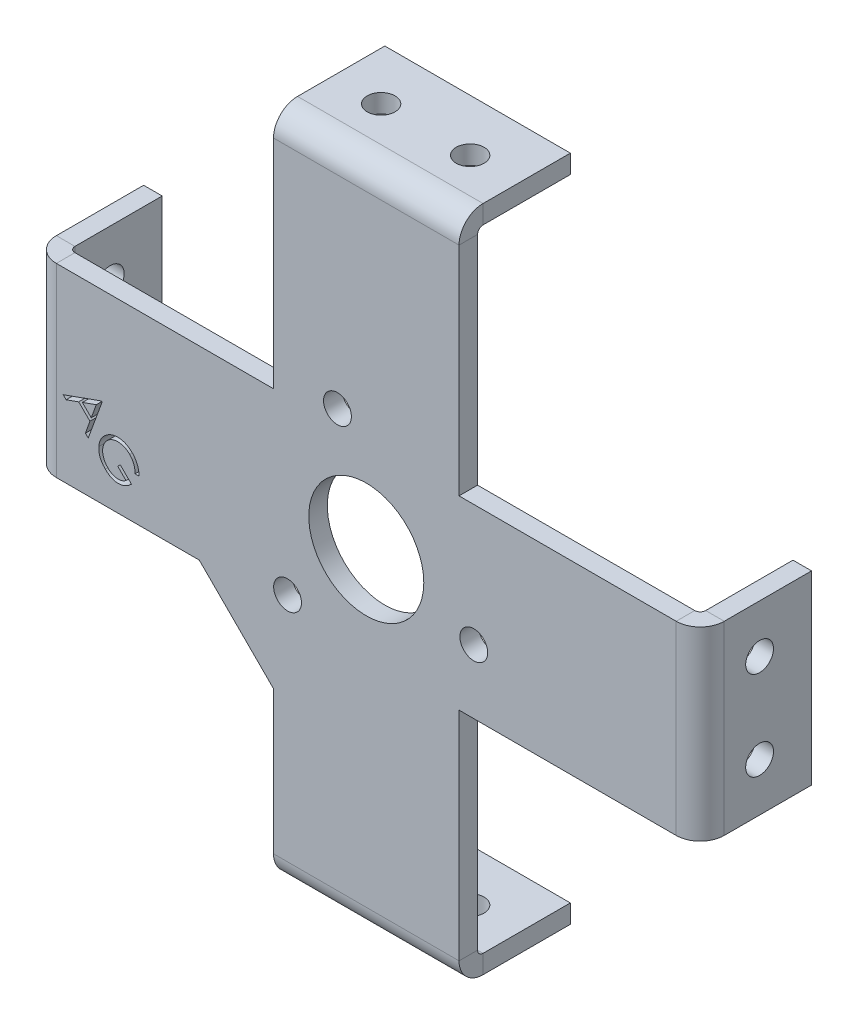
from build123d import *

# Parameters (mm, degrees)
SKETCH1_R                    = 7.75
SKETCH1_R_2                  = 1.875
BASE_FLANGE1_DEPTH           = 2.5
EDGE_FLANGE1_STRIP_W         = 11.4732
EDGE_FLANGE1_STRIP_H         = 2.5
EDGE_FLANGE1_STRIP_CUT_DEPTH = 25
EDGE_FLANGE1_DEPTH           = 25
EDGE_FLANGE2_STRIP_W         = 11.4732
EDGE_FLANGE2_STRIP_H         = 2.5
EDGE_FLANGE2_STRIP_CUT_DEPTH = 25
EDGE_FLANGE2_DEPTH           = 25
EDGE_FLANGE3_STRIP_W         = 11.4732
EDGE_FLANGE3_STRIP_H         = 2.5
EDGE_FLANGE3_STRIP_CUT_DEPTH = 25
EDGE_FLANGE3_DEPTH           = 25
EDGE_FLANGE4_STRIP_W         = 11.4732
EDGE_FLANGE4_STRIP_H         = 2.5
EDGE_FLANGE4_STRIP_CUT_DEPTH = 25
EDGE_FLANGE4_DEPTH           = 25
SKETCH18_R                   = 1.875
CUT_EXTRUDE1_DEPTH           = 102.734949747
CIRPATTERN1_COUNT            = 2
CIRPATTERN1_ANGLE            = 90
CHAMFER1_SIZE                = 10
CUT_EXTRUDE2_REACH           = 67.383


# Sheet-metal steps are written as plain solids
with BuildPart() as part:
    # Sketch1 → Base-Flange1 (new body)
    with BuildSketch(Plane.XY):
        Polygon((-45, 12.5), (-12.5, 12.5), (-12.5, 45), (12.5, 45), (12.5, 12.5), (45, 12.5), (45, -12.5), (12.5, -12.5), (12.5, -45), (-12.5, -45), (-12.5, -12.5), (-45, -12.5), align=None)
        Circle(SKETCH1_R, mode=Mode.SUBTRACT)
        with Locations((14.488887394, -3.882285677)):
            Circle(SKETCH1_R_2, mode=Mode.SUBTRACT)
        with Locations((-3.882285677, 14.488887394)):
            Circle(SKETCH1_R_2, mode=Mode.SUBTRACT)
        with Locations((-10.606601718, -10.606601718)):
            Circle(SKETCH1_R_2, mode=Mode.SUBTRACT)
    extrude(amount=-BASE_FLANGE1_DEPTH)

    # Edge-Flange1 strip (across the edge) → Edge-Flange1 strip cut (cut)
    with BuildSketch(Plane(origin=(-45, -12.5, -2.5), x_dir=(1, 0, 0), z_dir=(0, 1, 0))):
        with Locations((-2.5, -1.25)):
            Rectangle(EDGE_FLANGE1_STRIP_W, EDGE_FLANGE1_STRIP_H)
    extrude(amount=EDGE_FLANGE1_STRIP_CUT_DEPTH, mode=Mode.SUBTRACT)

    # Edge-Flange1 section (across the edge) → Edge-Flange1 (add)
    with BuildSketch(Plane(origin=(-45, -12.5, -2.5), x_dir=(1, 0, 0), z_dir=(0, 1, 0))):
        with BuildLine():
            Line((0, 0.7366), (0, 12.5))
            Line((0, 12.5), (2.5, 12.5))
            Line((2.5, 12.5), (2.5, 0.7366))
            ThreePointArc((2.5, 0.7366), (2.715745145, 0.215745145), (3.2366, 0))
            Line((3.2366, 0), (3.2366, -2.5))
            ThreePointArc((3.2366, -2.5), (0.947978192, -1.552021808), (0, 0.7366))
        make_face()
    extrude(amount=EDGE_FLANGE1_DEPTH)

    # Edge-Flange2 strip (across the edge) → Edge-Flange2 strip cut (cut)
    with BuildSketch(Plane(origin=(-12.5, 45, -2.5), x_dir=(0, -1, 0), z_dir=(1, 0, 0))):
        with Locations((-2.5, -1.25)):
            Rectangle(EDGE_FLANGE2_STRIP_W, EDGE_FLANGE2_STRIP_H)
    extrude(amount=EDGE_FLANGE2_STRIP_CUT_DEPTH, mode=Mode.SUBTRACT)

    # Edge-Flange2 section (across the edge) → Edge-Flange2 (add)
    with BuildSketch(Plane(origin=(-12.5, 45, -2.5), x_dir=(0, -1, 0), z_dir=(1, 0, 0))):
        with BuildLine():
            Line((0, 0.7366), (0, 12.5))
            Line((0, 12.5), (2.5, 12.5))
            Line((2.5, 12.5), (2.5, 0.7366))
            ThreePointArc((2.5, 0.7366), (2.715745145, 0.215745145), (3.2366, 0))
            Line((3.2366, 0), (3.2366, -2.5))
            ThreePointArc((3.2366, -2.5), (0.947978192, -1.552021808), (0, 0.7366))
        make_face()
    extrude(amount=EDGE_FLANGE2_DEPTH)

    # Edge-Flange3 strip (across the edge) → Edge-Flange3 strip cut (cut)
    with BuildSketch(Plane(origin=(45, 12.5, -2.5), x_dir=(-1, 0, 0), z_dir=(0, -1, 0))):
        with Locations((-2.5, -1.25)):
            Rectangle(EDGE_FLANGE3_STRIP_W, EDGE_FLANGE3_STRIP_H)
    extrude(amount=EDGE_FLANGE3_STRIP_CUT_DEPTH, mode=Mode.SUBTRACT)

    # Edge-Flange3 section (across the edge) → Edge-Flange3 (add)
    with BuildSketch(Plane(origin=(45, 12.5, -2.5), x_dir=(-1, 0, 0), z_dir=(0, -1, 0))):
        with BuildLine():
            Line((0, 0.7366), (0, 12.5))
            Line((0, 12.5), (2.5, 12.5))
            Line((2.5, 12.5), (2.5, 0.7366))
            ThreePointArc((2.5, 0.7366), (2.715745145, 0.215745145), (3.2366, 0))
            Line((3.2366, 0), (3.2366, -2.5))
            ThreePointArc((3.2366, -2.5), (0.947978192, -1.552021808), (0, 0.7366))
        make_face()
    extrude(amount=EDGE_FLANGE3_DEPTH)

    # Edge-Flange4 strip (across the edge) → Edge-Flange4 strip cut (cut)
    with BuildSketch(Plane(origin=(12.5, -45, -2.5), x_dir=(0, 1, 0), z_dir=(-1, 0, 0))):
        with Locations((-2.5, -1.25)):
            Rectangle(EDGE_FLANGE4_STRIP_W, EDGE_FLANGE4_STRIP_H)
    extrude(amount=EDGE_FLANGE4_STRIP_CUT_DEPTH, mode=Mode.SUBTRACT)

    # Edge-Flange4 section (across the edge) → Edge-Flange4 (add)
    with BuildSketch(Plane(origin=(12.5, -45, -2.5), x_dir=(0, 1, 0), z_dir=(-1, 0, 0))):
        with BuildLine():
            Line((0, 0.7366), (0, 12.5))
            Line((0, 12.5), (2.5, 12.5))
            Line((2.5, 12.5), (2.5, 0.7366))
            ThreePointArc((2.5, 0.7366), (2.715745145, 0.215745145), (3.2366, 0))
            Line((3.2366, 0), (3.2366, -2.5))
            ThreePointArc((3.2366, -2.5), (0.947978192, -1.552021808), (0, 0.7366))
        make_face()
    extrude(amount=EDGE_FLANGE4_DEPTH)

    # Sketch18 → Cut-Extrude1 (cut, through all)
    with BuildSketch(Plane.XZ.offset(45)):
        with Locations(Location((6, -8, 0), (0, 0, 270))):
            Circle(SKETCH18_R)
        with Locations(Location((-6, -8, 0), (0, 0, 270))):
            Circle(SKETCH18_R)
    cut_extrude1 = extrude(amount=-CUT_EXTRUDE1_DEPTH, mode=Mode.SUBTRACT)

    # CirPattern1: Cut-Extrude1 ×2 about axis
    cirpattern1_axis = Axis((0, 0, -2.5), (0, 0, 1))
    for i in range(1, CIRPATTERN1_COUNT):
        add(cut_extrude1.rotate(cirpattern1_axis, i * CIRPATTERN1_ANGLE / (CIRPATTERN1_COUNT - 1)), mode=Mode.SUBTRACT)

    # Chamfer1
    chamfer1_edges = [part.edges().sort_by_distance(p)[0] for p in [
        (-12.5, -12.5, -1.25),
    ]]
    chamfer(chamfer1_edges, length=CHAMFER1_SIZE)

    # Sketch19 → Cut-Extrude2 (cut, up to next)
    with BuildSketch(Plane.XY, mode=Mode.PRIVATE) as cut_extrude2_sk1:
        Polygon((-35.59875844, -0.60445976), (-37.466747222, -5.735669696), (-37.842348184, -5.360068735), (-37.240385043, -3.658345978), (-38.748798504, -2.149932517), (-40.447516453, -2.754900466), (-40.838141453, -2.364275466), (-35.684896261, -0.51832194), align=None)
        Polygon((-36.38401485, -1.30357835), (-38.254006837, -1.969644055), (-37.057091773, -3.166559119), align=None, mode=Mode.SUBTRACT)
    cut_extrude2_tool1 = extrude(cut_extrude2_sk1.sketch, amount=-CUT_EXTRUDE2_REACH, mode=Mode.PRIVATE) & part.part
    # Sketch19 → Cut-Extrude2 (cut, up to next)
    with BuildSketch(Plane.XY, mode=Mode.PRIVATE) as cut_extrude2_sk2:
        with BuildLine():
            Line((-30.615398344, -6.763701267), (-31.142241293, -6.749678831))
            add(Edge.make_bspline(
                [(-31.142241293, -6.749678831), (-31.145489868, -6.654395136), (-31.151888753, -6.466709961), (-31.191755294, -6.19060039), (-31.256051919, -5.925522565), (-31.342853817, -5.672300597), (-31.450583003, -5.435210498), (-31.574868793, -5.216438847), (-31.715950903, -5.017962189), (-31.82468821, -4.901283993), (-31.878419178, -4.843629151)],
                knots=[0, 0, 0, 0, 1.092456216, 2.151866967, 3.191698867, 4.215812801, 5.216260249, 6.172962659, 7.097195931, 8, 8, 8, 8], degree=3))
            add(Edge.make_bspline(
                [(-31.878419178, -4.843629151), (-31.913029226, -4.810085313), (-31.981877561, -4.743357945), (-32.093010927, -4.652076639), (-32.208789876, -4.568188826), (-32.329828018, -4.491475146), (-32.455649736, -4.422623603), (-32.586818346, -4.361190038), (-32.722841699, -4.307003842), (-32.863536633, -4.261560473), (-33.005791237, -4.223261605), (-33.148663359, -4.195070624), (-33.290893746, -4.176907132), (-33.432461427, -4.16918509), (-33.573012941, -4.169771608), (-33.712914336, -4.1810242), (-33.852200007, -4.201892822), (-33.989800368, -4.233397375), (-34.124546629, -4.271682787), (-34.254281199, -4.319621186), (-34.379576304, -4.372979421), (-34.49928237, -4.435542074), (-34.613457645, -4.505890078), (-34.723144014, -4.583122338), (-34.827513812, -4.668237285), (-34.892633759, -4.730347054), (-34.925294178, -4.761497741)],
                knots=[0, 0, 0, 0, 1.025427365, 2.039840153, 3.057507816, 4.066806032, 5.087569815, 6.10793782, 7.147691792, 8.201553679, 9.252921328, 10.281347815, 11.298419945, 12.301923675, 13.296735835, 14.287504905, 15.286394337, 16.291406341, 17.289891323, 18.265459552, 19.232998703, 20.186450044, 21.137010966, 22.085285157, 23.039689209, 24, 24, 24, 24], degree=3))
            add(Edge.make_bspline(
                [(-34.925294178, -4.761497741), (-34.957616924, -4.794680579), (-35.021940545, -4.86071582), (-35.107450015, -4.969113982), (-35.187133222, -5.080988473), (-35.258292268, -5.199057829), (-35.322776116, -5.321766455), (-35.377378419, -5.450817312), (-35.42604101, -5.584313896), (-35.46565681, -5.722898014), (-35.496841632, -5.86436058), (-35.517459985, -6.006989821), (-35.530372175, -6.149454769), (-35.530520308, -6.292393273), (-35.523003453, -6.435967526), (-35.504515049, -6.579747446), (-35.477815116, -6.724165432), (-35.439446432, -6.867504275), (-35.39246711, -7.009238615), (-35.337784018, -7.147770936), (-35.272912139, -7.281648686), (-35.200205185, -7.411575126), (-35.118210821, -7.537195049), (-35.029540664, -7.659634789), (-34.931025433, -7.777351247), (-34.859328291, -7.851211358), (-34.823130716, -7.888500946)],
                knots=[0, 0, 0, 0, 0.958164642, 1.906787844, 2.853899696, 3.799624022, 4.757763745, 5.720477666, 6.697567859, 7.697077279, 8.701447969, 9.693380152, 10.678137543, 11.659421694, 12.649136943, 13.651961257, 14.657591078, 15.68673578, 16.720348352, 17.746914642, 18.766854241, 19.797135108, 20.826418999, 21.869962865, 22.924612933, 24, 24, 24, 24], degree=3))
            add(Edge.make_bspline(
                [(-34.823130716, -7.888500946), (-34.778003815, -7.931585494), (-34.68922766, -8.016343818), (-34.5474528, -8.129926389), (-34.401033898, -8.228445627), (-34.250044472, -8.311837301), (-34.095490563, -8.3814978), (-33.936261805, -8.436059368), (-33.772470152, -8.474812717), (-33.605974627, -8.49983072), (-33.439002376, -8.510326079), (-33.274766388, -8.503748511), (-33.113947527, -8.484342118), (-32.957382104, -8.447780334), (-32.804395886, -8.396572016), (-32.655665758, -8.329872049), (-32.51046355, -8.248868694), (-32.419372798, -8.18386345), (-32.373210844, -8.150920818)],
                knots=[0, 0, 0, 0, 1.108635511, 2.180969593, 3.22450757, 4.241882241, 5.243346914, 6.234258488, 7.228894973, 8.231010033, 9.223856758, 10.197775715, 11.148806295, 12.098929147, 13.050404013, 14.012095734, 14.992592072, 16, 16, 16, 16], degree=3))
            Line((-32.373210844, -8.150920818), (-33.488996101, -7.035135561))
            Line((-33.488996101, -7.035135561), (-33.151456036, -6.697595497))
            Line((-33.151456036, -6.697595497), (-31.643042575, -8.206008959))
            add(Edge.make_bspline(
                [(-31.643042575, -8.206008959), (-31.710847329, -8.269879572), (-31.843432408, -8.39477185), (-32.054280455, -8.559411619), (-32.269615783, -8.698951269), (-32.489679156, -8.812748059), (-32.714099891, -8.901650717), (-32.943034663, -8.965383789), (-33.176470493, -9.003567716), (-33.412824348, -9.016306456), (-33.648712009, -9.005073725), (-33.880824811, -8.965810593), (-34.108618105, -8.904250507), (-34.330773532, -8.814380371), (-34.549047899, -8.702379799), (-34.761079824, -8.563186417), (-34.96957641, -8.401111192), (-35.099313736, -8.276674023), (-35.165678793, -8.213020177)],
                knots=[0, 0, 0, 0, 1.124353718, 2.198555655, 3.225130206, 4.218636519, 5.185134441, 6.134880843, 7.082657188, 8.035538682, 8.98820694, 9.928027176, 10.872814929, 11.831817233, 12.816309525, 13.830539726, 14.890247245, 16, 16, 16, 16], degree=3))
            add(Edge.make_bspline(
                [(-35.165678793, -8.213020177), (-35.205107621, -8.172632163), (-35.283046578, -8.092797185), (-35.392146005, -7.96855692), (-35.492893552, -7.84194898), (-35.584506697, -7.712809157), (-35.669342805, -7.582693719), (-35.744431609, -7.449986315), (-35.811630782, -7.315606086), (-35.871257214, -7.179456291), (-35.92066286, -7.040528424), (-35.964931389, -6.900684972), (-35.997009124, -6.757364935), (-36.02372258, -6.612829684), (-36.040423443, -6.465896726), (-36.049323459, -6.317469835), (-36.051004455, -6.166944745), (-36.044403842, -6.066229522), (-36.041079434, -6.015504151)],
                knots=[0, 0, 0, 0, 1.107566553, 2.189326602, 3.243326291, 4.281504776, 5.295647464, 6.290406643, 7.272045444, 8.243396274, 9.205130522, 10.164742004, 11.119958982, 12.085191145, 13.048285964, 14.019813572, 15.002676199, 16, 16, 16, 16], degree=3))
            add(Edge.make_bspline(
                [(-36.041079434, -6.015504151), (-36.033064194, -5.937858958), (-36.01723912, -5.784558374), (-35.970596601, -5.560208223), (-35.905040798, -5.344873727), (-35.822016899, -5.13770288), (-35.719406908, -4.939432237), (-35.597019626, -4.750778093), (-35.458252118, -4.56926706), (-35.352374446, -4.458084578), (-35.298891934, -4.40192242)],
                knots=[0, 0, 0, 0, 1.031657029, 2.036875928, 3.024253801, 4.004738347, 4.98410909, 5.971131592, 6.975147659, 8, 8, 8, 8], degree=3))
            add(Edge.make_bspline(
                [(-35.298891934, -4.40192242), (-35.256995922, -4.361637146), (-35.173890736, -4.28172703), (-35.041004543, -4.172279211), (-34.902196605, -4.073030062), (-34.758240428, -3.982337305), (-34.607526719, -3.903456147), (-34.45150655, -3.83422029), (-34.290572158, -3.773690629), (-34.124281629, -3.725321738), (-33.955900429, -3.685919231), (-33.785877652, -3.658714638), (-33.615827094, -3.643947364), (-33.445895161, -3.639990876), (-33.276120562, -3.646352682), (-33.106574062, -3.667162724), (-32.936999991, -3.698253762), (-32.767825252, -3.739963649), (-32.600933335, -3.794151957), (-32.437299319, -3.859354989), (-32.277710727, -3.935686076), (-32.12218641, -4.023086877), (-31.970207529, -4.121662826), (-31.82274215, -4.23184233), (-31.678178164, -4.352122161), (-31.587712564, -4.440354835), (-31.541880716, -4.485055433)],
                knots=[0, 0, 0, 0, 0.99776897, 1.979180644, 2.952859251, 3.926385947, 4.898307682, 5.870989991, 6.856011898, 7.84828111, 8.842618362, 9.823778832, 10.802171802, 11.771316612, 12.741020832, 13.716655297, 14.701693886, 15.700039149, 16.706254557, 17.712290297, 18.72261299, 19.741632886, 20.773648741, 21.830820032, 22.90104608, 24, 24, 24, 24], degree=3))
            add(Edge.make_bspline(
                [(-31.541880716, -4.485055433), (-31.505449635, -4.522434626), (-31.433170672, -4.596594636), (-31.332112751, -4.713134807), (-31.237506813, -4.832771976), (-31.149535179, -4.955732011), (-31.067897048, -5.082193316), (-30.994165861, -5.212692424), (-30.925790121, -5.345771595), (-30.864147376, -5.48267187), (-30.810408806, -5.624369799), (-30.761753191, -5.770854251), (-30.721309683, -5.923228405), (-30.685941879, -6.080495246), (-30.657859986, -6.243293847), (-30.63734491, -6.411807515), (-30.621725174, -6.585831588), (-30.617525225, -6.703907098), (-30.615398344, -6.763701267)],
                knots=[0, 0, 0, 0, 0.991934739, 1.967990295, 2.930334189, 3.890080094, 4.840634758, 5.789896394, 6.737820757, 7.683703736, 8.641853842, 9.617145815, 10.616200278, 11.636966968, 12.680248832, 13.754660401, 14.862946132, 16, 16, 16, 16], degree=3))
        make_face()
    cut_extrude2_tool2 = extrude(cut_extrude2_sk2.sketch, amount=-CUT_EXTRUDE2_REACH, mode=Mode.PRIVATE) & part.part
    add(cut_extrude2_tool1.solids().sort_by_distance((-36.602232, -3.144771, 0))[0], mode=Mode.SUBTRACT)
    add(cut_extrude2_tool2.solids().sort_by_distance((-30.876787, -6.680312, 0))[0], mode=Mode.SUBTRACT)


with BuildPart() as cut_extrude2_piece_1:
    # of the separate pieces the step leaves, piece 1, a body of its own (cut_extrude2_pieces)
    add(part.part.solids().sort_by_distance((-22.5, -12.5, 0))[0])


with BuildPart() as cut_extrude2_piece_2:
    # of the separate pieces the step leaves, piece 2, a body of its own (cut_extrude2_pieces)
    add(part.part.solids().sort_by_distance((-36.38401485, -1.30357835, 0))[0])


solid = Compound([cut_extrude2_piece_1.part, cut_extrude2_piece_2.part])
